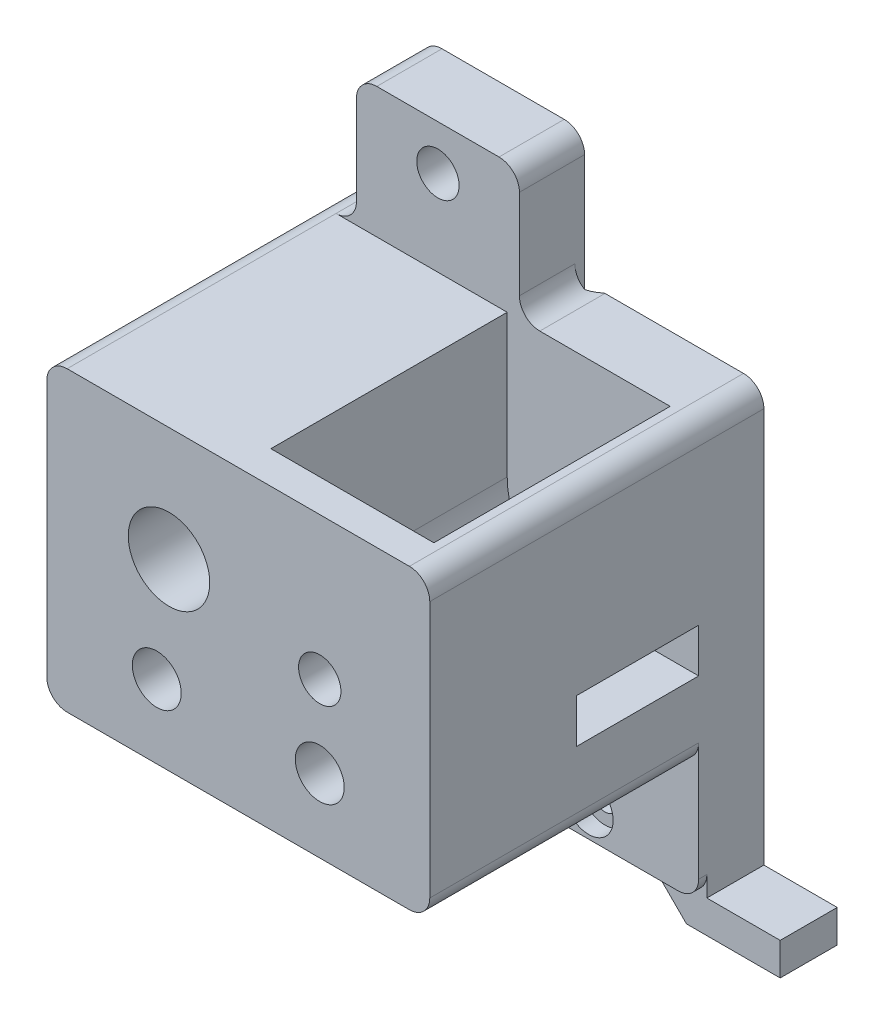
from build123d import *

# Parameters (mm, degrees)
EXTRUDE_1_DEPTH             = 8
EXTRUDE_9_DEPTH             = 29
SKETCH_25_W                 = 47
SKETCH_25_H                 = 36.5
EXTRUDE_10_DEPTH            = 4
HOLE_WIZARD_M51_D           = 3.2
HOLE_WIZARD_M51_CBORE_D     = 6
HOLE_WIZARD_M51_CBORE_DEPTH = 35
SKETCH_22_R                 = 2.6
CUT_EXTRUDE_9_DEPTH         = 92.536877814
CUT_EXTRUDE_10_DEPTH        = 4.2
HOLE_WIZARD_M52_D           = 5.2
HOLE_WIZARD_M52_CBORE_D     = 10
HOLE_WIZARD_M52_CBORE_DEPTH = 33
CUT_EXTRUDE_11_DEPTH        = 24
FILLET_1_R                  = 2.5
EXTRUDE_11_DEPTH            = 7
SKETCH_32_W                 = 15
SKETCH_32_H                 = 5.4
CUT_EXTRUDE_12_DEPTH        = 13.5
SKETCH_33_W                 = 15
SKETCH_33_H                 = 5.4
CUT_EXTRUDE_13_DEPTH        = 33.5


with BuildPart() as part:
    # Эскиз1 → Бобышка-Вытянуть1 (new body)
    with BuildSketch(Plane.XY):
        Polygon((-47, 51), (-47, 0), (0, 0), (0, 51), (-22, 51), (-22, 67), (-42, 67), (-42, 51), align=None)
    extrude(amount=EXTRUDE_1_DEPTH)

    # Эскиз24 → Бобышка-Вытянуть9 (add)
    with BuildSketch(Plane.XY.offset(8)):
        with BuildLine():
            Line((0, 51), (-3.5, 51))
            Line((-3.5, 51), (-3.5, 33.5))
            ThreePointArc((-3.5, 33.5), (-13.5, 23.5), (-23.5, 33.5))
            Line((-23.5, 33.5), (-23.5, 51))
            Line((-23.5, 51), (-47, 51))
            Line((-47, 51), (-47, 14.5))
            Line((-47, 14.5), (0, 14.5))
            Line((0, 14.5), (0, 51))
        make_face()
    extrude(amount=EXTRUDE_9_DEPTH)

    # Эскиз25 → Бобышка-Вытянуть10 (add)
    with BuildSketch(Plane.XY.offset(37)):
        with Locations((-23.5, 32.75)):
            Rectangle(SKETCH_25_W, SKETCH_25_H)
    extrude(amount=EXTRUDE_10_DEPTH)

    # Цековка для  болта с шестигранной головкой M51 (through all)
    with Locations(Plane(origin=(-33.5, 3.5, 41), x_dir=(1, 0, 0), z_dir=(0, 0, 1))):
        with Locations((0, 0), (0, 20), (20, 0), (20, 20)):
            CounterBoreHole(HOLE_WIZARD_M51_D / 2, HOLE_WIZARD_M51_CBORE_D / 2, HOLE_WIZARD_M51_CBORE_DEPTH)

    # Эскиз22 → Вырез-Вытянуть9 (cut, through all)
    with BuildSketch(Plane.XY):
        with Locations(Location((-13.5, 33.5, 0), (0, 0, 180))):
            Circle(SKETCH_22_R)
    extrude(amount=CUT_EXTRUDE_9_DEPTH, mode=Mode.SUBTRACT)

    # Эскиз23 → Вырез-Вытянуть10 (cut)
    with BuildSketch(Plane(origin=(0, 0, 0), x_dir=(-1, 0, 0), z_dir=(0, 0, -1))):
        Polygon((13.5, 38.234272207), (9.4, 35.867136104), (9.4, 31.132863896), (13.5, 28.765727793), (17.6, 31.132863896), (17.6, 35.867136104), align=None)
    extrude(amount=-CUT_EXTRUDE_10_DEPTH, mode=Mode.SUBTRACT)

    # Цековка для  болта с шестигранной головкой M52 (through all)
    with Locations(Plane(origin=(-32, 61.5, 41), x_dir=(1, 0, 0), z_dir=(0, 0, 1))):
        with Locations((0, 0), (0, -24.5)):
            CounterBoreHole(HOLE_WIZARD_M52_D / 2, HOLE_WIZARD_M52_CBORE_D / 2, HOLE_WIZARD_M52_CBORE_DEPTH)

    # Эскиз30 → Вырез-Вытянуть11 (cut)
    with BuildSketch(Plane(origin=(0, 51, 0), x_dir=(1, 0, 0), z_dir=(0, 1, 0))):
        Polygon((-42, 0), (-42, -1.2), (-43.2, -1.2), (-44.4, 0), align=None)
        Polygon((-22, 0), (-22, -1.2), (-20.8, -1.2), (-19.6, 0), align=None)
    extrude(amount=-CUT_EXTRUDE_11_DEPTH, mode=Mode.SUBTRACT)

    # Скругление1
    # the kernel refuses this fillet: 2.5 mm, written as the material it adds along each edge
    with BuildSketch(Plane(origin=(-22, 51, -5.05), x_dir=(0, 1, 0), z_dir=(0, 0, 1))) as fillet_1_piece_1_section:
        with BuildLine():
            CenterArc((FILLET_1_R, -FILLET_1_R), FILLET_1_R, 90, 90)
            Line((0, -FILLET_1_R), (0, 0))
            Line((0, 0), (FILLET_1_R, 0))
        make_face()
    fillet_1_piece_1 = extrude(amount=13.05, mode=Mode.PRIVATE)
    fillet_1_piece_1 = split(fillet_1_piece_1, bisect_by=Plane(origin=(-20.123471849, 51.026696565, 0), z_dir=(0, 0, 1)), keep=Keep.TOP, mode=Mode.PRIVATE)
    fillet_1_piece_1 = split(fillet_1_piece_1, bisect_by=Plane(origin=(-20.123471849, 51.026696565, 1.2), z_dir=(0, 0, -1)), keep=Keep.TOP, mode=Mode.PRIVATE)
    fillet_1_piece_1 = split(fillet_1_piece_1, bisect_by=Plane(origin=(-20.293433634, 51.026696565, 0.693433634), z_dir=(0.7071067811865498, 0, 0.7071067811865455)), keep=Keep.TOP, mode=Mode.PRIVATE)
    add(fillet_1_piece_1)
    with BuildSketch(Plane(origin=(-22, 51, 1.2), x_dir=(0, 1, 0), z_dir=(0, 0, 1))) as fillet_1_piece_2_section:
        with BuildLine():
            CenterArc((FILLET_1_R, -FILLET_1_R), FILLET_1_R, 90, 90)
            Line((0, -FILLET_1_R), (0, 0))
            Line((0, 0), (FILLET_1_R, 0))
        make_face()
    fillet_1_piece_2 = extrude(amount=6.8, mode=Mode.PRIVATE)
    fillet_1_piece_2 = split(fillet_1_piece_2, bisect_by=Plane(origin=(-21.509165304, 51.769559816, 1.909165304), z_dir=(-0.7071067811865498, 0, -0.7071067811865455)), keep=Keep.TOP, mode=Mode.PRIVATE)
    add(fillet_1_piece_2)
    with BuildSketch(Plane(origin=(-22, 51, 1.2), x_dir=(0, 1, 0), z_dir=(0, 0, 1))) as fillet_1_piece_3_section:
        with BuildLine():
            CenterArc((FILLET_1_R, -FILLET_1_R), FILLET_1_R, 90, 90)
            Line((0, -FILLET_1_R), (0, 0))
            Line((0, 0), (FILLET_1_R, 0))
        make_face()
    fillet_1_piece_3 = extrude(amount=6.8, mode=Mode.PRIVATE)
    fillet_1_piece_3 = split(fillet_1_piece_3, bisect_by=Plane(origin=(-22.965000899, 51.542951648, 3.365000899), z_dir=(0.7071067811865498, 0, 0.7071067811865455)), keep=Keep.TOP, mode=Mode.PRIVATE)
    add(fillet_1_piece_3)
    with BuildSketch(Plane(origin=(-42, 51, -5.05), x_dir=(0, 1, 0), z_dir=(0, 0, 1))) as fillet_1_piece_4_section:
        with BuildLine():
            CenterArc((FILLET_1_R, FILLET_1_R), FILLET_1_R, 180, 90)
            Line((0, FILLET_1_R), (0, 0))
            Line((0, 0), (FILLET_1_R, 0))
        make_face()
    fillet_1_piece_4 = extrude(amount=13.05, mode=Mode.PRIVATE)
    fillet_1_piece_4 = split(fillet_1_piece_4, bisect_by=Plane(origin=(-43.876528151, 51.026696565, 0), z_dir=(0, 0, 1)), keep=Keep.TOP, mode=Mode.PRIVATE)
    fillet_1_piece_4 = split(fillet_1_piece_4, bisect_by=Plane(origin=(-43.706566366, 51.026696565, 0.693433634), z_dir=(-0.7071067811865488, 0, 0.7071067811865464)), keep=Keep.TOP, mode=Mode.PRIVATE)
    fillet_1_piece_4 = split(fillet_1_piece_4, bisect_by=Plane(origin=(-43.876528151, 51.026696565, 1.2), z_dir=(0, 0, -1)), keep=Keep.TOP, mode=Mode.PRIVATE)
    add(fillet_1_piece_4)
    with BuildSketch(Plane(origin=(-42, 51, 1.2), x_dir=(0, 1, 0), z_dir=(0, 0, 1))) as fillet_1_piece_5_section:
        with BuildLine():
            CenterArc((FILLET_1_R, FILLET_1_R), FILLET_1_R, 180, 90)
            Line((0, FILLET_1_R), (0, 0))
            Line((0, 0), (FILLET_1_R, 0))
        make_face()
    fillet_1_piece_5 = extrude(amount=6.8, mode=Mode.PRIVATE)
    fillet_1_piece_5 = split(fillet_1_piece_5, bisect_by=Plane(origin=(-42.490834696, 51.769559816, 1.909165304), z_dir=(0.7071067811865488, 0, -0.7071067811865464)), keep=Keep.TOP, mode=Mode.PRIVATE)
    add(fillet_1_piece_5)
    with BuildSketch(Plane(origin=(-42, 51, 1.2), x_dir=(0, 1, 0), z_dir=(0, 0, 1))) as fillet_1_piece_6_section:
        with BuildLine():
            CenterArc((FILLET_1_R, FILLET_1_R), FILLET_1_R, 180, 90)
            Line((0, FILLET_1_R), (0, 0))
            Line((0, 0), (FILLET_1_R, 0))
        make_face()
    fillet_1_piece_6 = extrude(amount=6.8, mode=Mode.PRIVATE)
    fillet_1_piece_6 = split(fillet_1_piece_6, bisect_by=Plane(origin=(-41.034999101, 51.542951648, 3.365000899), z_dir=(-0.7071067811865488, 0, 0.7071067811865464)), keep=Keep.TOP, mode=Mode.PRIVATE)
    add(fillet_1_piece_6)
    # the kernel refuses this fillet: 2.5 mm, written as the material it takes off along each edge
    with BuildSketch(Plane(origin=(-47, 0, -6.25), x_dir=(0, 1, 0), z_dir=(0, 0, 1))) as fillet_1_2_piece_1:
        with BuildLine():
            CenterArc((FILLET_1_R, -FILLET_1_R), FILLET_1_R, 90, 90)
            Line((0, -FILLET_1_R), (0, 0))
            Line((0, 0), (FILLET_1_R, 0))
        make_face()
    extrude(amount=20.5, mode=Mode.SUBTRACT)
    with BuildSketch(Plane(origin=(-22, 67, -6.25), x_dir=(-1, 0, 0), z_dir=(0, 0, 1)), Plane(origin=(0, 0, -6.25), x_dir=(0, 1, 0), z_dir=(0, 0, 1)), Plane(origin=(-42, 67, -6.25), x_dir=(0, -1, 0), z_dir=(0, 0, 1))) as fillet_1_2_piece_2:
        with BuildLine():
            CenterArc((FILLET_1_R, FILLET_1_R), FILLET_1_R, 180, 90)
            Line((0, FILLET_1_R), (0, 0))
            Line((0, 0), (FILLET_1_R, 0))
        make_face()
    extrude(amount=20.5, mode=Mode.SUBTRACT)
    with BuildSketch(Plane(origin=(0, 51, 47.25), x_dir=(0, -1, 0), z_dir=(0, 0, -1))) as fillet_1_2_piece_3:
        with BuildLine():
            CenterArc((FILLET_1_R, FILLET_1_R), FILLET_1_R, 180, 90)
            Line((0, FILLET_1_R), (0, 0))
            Line((0, 0), (FILLET_1_R, 0))
        make_face()
    extrude(amount=53.5, mode=Mode.SUBTRACT)
    with BuildSketch(Plane(origin=(-47, 51, 47.25), x_dir=(0, -1, 0), z_dir=(0, 0, -1))) as fillet_1_2_piece_4:
        with BuildLine():
            CenterArc((FILLET_1_R, -FILLET_1_R), FILLET_1_R, 90, 90)
            Line((0, -FILLET_1_R), (0, 0))
            Line((0, 0), (FILLET_1_R, 0))
        make_face()
    extrude(amount=53.5, mode=Mode.SUBTRACT)
    with BuildSketch(Plane(origin=(-47, 14.5, 8), x_dir=(0, 1, 0), z_dir=(0, 0, 1))) as fillet_1_2_piece_5:
        with BuildLine():
            CenterArc((FILLET_1_R, -FILLET_1_R), FILLET_1_R, 90, 90)
            Line((0, -FILLET_1_R), (0, 0))
            Line((0, 0), (FILLET_1_R, 0))
        make_face()
    extrude(amount=39.25, mode=Mode.SUBTRACT)
    with BuildSketch(Plane(origin=(0, 14.5, 8), x_dir=(0, 1, 0), z_dir=(0, 0, 1))) as fillet_1_2_piece_6:
        with BuildLine():
            CenterArc((FILLET_1_R, FILLET_1_R), FILLET_1_R, 180, 90)
            Line((0, FILLET_1_R), (0, 0))
            Line((0, 0), (FILLET_1_R, 0))
        make_face()
    extrude(amount=39.25, mode=Mode.SUBTRACT)

    # Эскиз31 → Бобышка-Вытянуть11 (add)
    with BuildSketch(Plane(origin=(0, 0, 0), x_dir=(-1, 0, 0), z_dir=(0, 0, -1))):
        with BuildLine():
            Line((0, 0), (-9, 0))
            Line((-9, 0), (-9, -4))
            Line((-9, -4), (2.5, -4))
            Line((2.5, -4), (6.5, 0))
            Line((6.5, 0), (2.5, 0))
            ThreePointArc((2.5, 0), (0.732233047, 0.732233047), (0, 2.5))
            Line((0, 2.5), (0, 0))
        make_face()
    extrude(amount=-EXTRUDE_11_DEPTH)

    # Эскиз32 → Вырез-Вытянуть12 (cut)
    with BuildSketch(Plane(origin=(0, 0, 0), x_dir=(0, 0, -1), z_dir=(1, 0, 0))):
        with Locations((-15.5, 26.8)):
            Rectangle(SKETCH_32_W, SKETCH_32_H)
    extrude(amount=-CUT_EXTRUDE_12_DEPTH, mode=Mode.SUBTRACT)

    # Эскиз33 → Вырез-Вытянуть13 (cut)
    with BuildSketch(Plane.ZY.offset(47)):
        with Locations((29.5, 26.8)):
            Rectangle(SKETCH_33_W, SKETCH_33_H)
    extrude(amount=-CUT_EXTRUDE_13_DEPTH, mode=Mode.SUBTRACT)


solid = part.part
